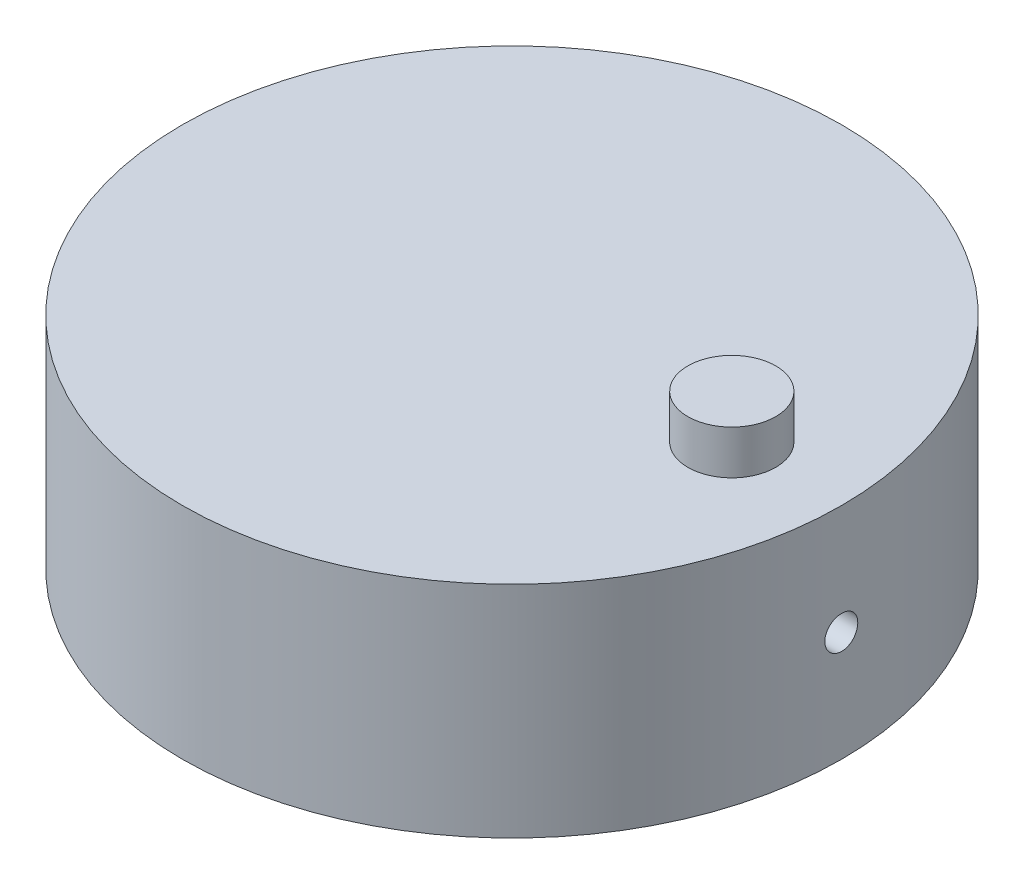
from build123d import *

# Parameters (mm, degrees)
SKETCH1_R               = 38.1
BOSS_EXTRUDE1_DEPTH     = 25.4
SKETCH2_R               = 5.08
BOSS_EXTRUDE2_DEPTH     = 5.08
CUT_EXTRUDE1_DEPTH      = 46.228
CUT_EXTRUDE1_DEPTH_BACK = 46.482
SKETCH3_R               = 1.905


with BuildPart() as part:
    # Sketch1 → Boss-Extrude1 (new body)
    with BuildSketch(Plane(origin=(0, 0, 0), x_dir=(1, 0, 0), z_dir=(0, 1, 0))):
        Circle(SKETCH1_R)
    extrude(amount=BOSS_EXTRUDE1_DEPTH)

    # Sketch2 → Boss-Extrude2 (add)
    with BuildSketch(Plane(origin=(0, 25.4, 0), x_dir=(1, 0, 0), z_dir=(0, 1, 0))):
        with Locations((25.4, 0)):
            Circle(SKETCH2_R)
    extrude(amount=BOSS_EXTRUDE2_DEPTH)

    # Sketch3 → Cut-Extrude1 (cut, two sides: drawn at the far end of the back side and taken through both)
    with BuildSketch(Plane(origin=(0, 0, 0), x_dir=(0, 0, -1), z_dir=(1, 0, 0)).offset(-CUT_EXTRUDE1_DEPTH_BACK)):
        with Locations((0, 12.7)):
            Circle(SKETCH3_R)
    extrude(amount=CUT_EXTRUDE1_DEPTH + CUT_EXTRUDE1_DEPTH_BACK, mode=Mode.SUBTRACT)


solid = part.part
